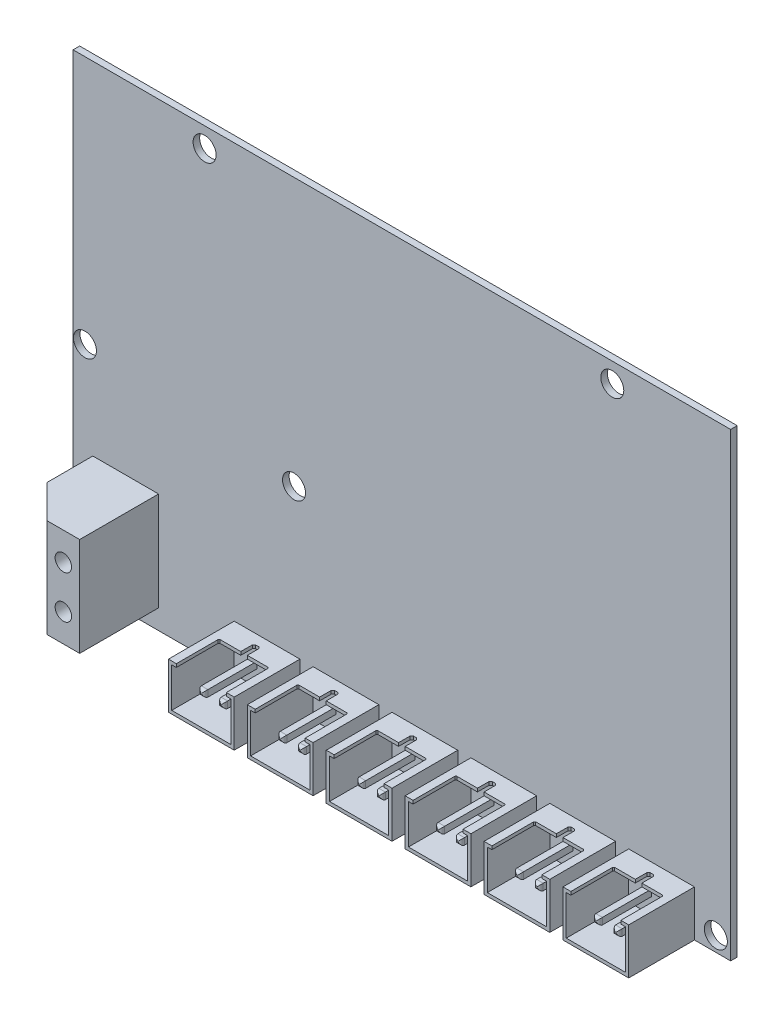
from build123d import *

# Parameters (mm, degrees)
CROQUIS1_W              = 100
CROQUIS1_H              = 70
CROQUIS1_R              = 1.75
SALIENTE_EXTRUIR1_DEPTH = 1
CROQUIS3_W              = 10
CROQUIS3_H              = 7
SALIENTE_EXTRUIR3_DEPTH = 10
VACIADO3_T              = -0.5
CORTAR_EXTRUIR1_DEPTH   = 1
CROQUIS6_W              = 1
CROQUIS6_H              = 1
SALIENTE_EXTRUIR4_DEPTH = 8
REDONDEO1_R             = 0.5
MATRIZL4_COUNT          = 6
MATRIZL4_PITCH          = 12
VACIADO4_T              = -0.5
VACIADO5_T              = -0.5
VACIADO6_T              = -0.5
VACIADO7_T              = -0.5
VACIADO8_T              = -0.5
MATRIZL5_COUNT          = 6
MATRIZL5_PITCH          = 12
MATRIZL6_COUNT          = 6
MATRIZL6_PITCH          = 12
REDONDEO2_R             = 0.5
REDONDEO3_R             = 0.5
REDONDEO4_R             = 0.5
REDONDEO5_R             = 0.5
REDONDEO6_R             = 0.5
CROQUIS13_W             = 10
CROQUIS13_H             = 15
SALIENTE_EXTRUIR5_DEPTH = 12
CHAFL_N1_SIZE           = 5
CROQUIS15_R             = 1.25
CORTAR_EXTRUIR2_DEPTH   = 9
CROQUIS16_R             = 1.25
CORTAR_EXTRUIR3_DEPTH   = 9


with BuildPart() as part:
    # Croquis1 → Saliente-Extruir1 (new body)
    with BuildSketch(Plane.XY):
        with Locations((-13.508184332, 3.054316547)):
            Rectangle(CROQUIS1_W, CROQUIS1_H)
        with Locations((-61.708184332, 0.154316547)):
            Circle(CROQUIS1_R, mode=Mode.SUBTRACT)
        with Locations((-43.508184332, 35.054316547)):
            Circle(CROQUIS1_R, mode=Mode.SUBTRACT)
        with Locations((18.491815668, 35.054316547)):
            Circle(CROQUIS1_R, mode=Mode.SUBTRACT)
        with Locations((-29.908184332, -2.645683453)):
            Circle(CROQUIS1_R, mode=Mode.SUBTRACT)
        with Locations((34.241815668, -29.695683453)):
            Circle(CROQUIS1_R, mode=Mode.SUBTRACT)
    extrude(amount=SALIENTE_EXTRUIR1_DEPTH)


with BuildPart() as body_2:
    # Croquis3 → Saliente-Extruir3 (new body)
    with BuildSketch(Plane.XY.offset(1.5)):
        with Locations((26.491815668, -27.945683453)):
            Rectangle(CROQUIS3_W, CROQUIS3_H)
    saliente_extruir3 = extrude(amount=SALIENTE_EXTRUIR3_DEPTH)

    # Vaciado3
    vaciado3_openings = [body_2.faces().sort_by_distance(p)[0] for p in [
        (26.491815668, -27.945683453, 11.5),
    ]]
    offset(amount=VACIADO3_T, openings=vaciado3_openings, kind=Kind.INTERSECTION)

    # Croquis5 → Cortar-Extruir1 (cut)
    with BuildSketch(Plane(origin=(0, -24.445683453, 0), x_dir=(1, 0, 0), z_dir=(0, 1, 0))):
        Polygon((22.691815668, -11.5), (22.691815668, -5.15), (22.841815668, -5), (25.991815668, -5), (25.991815668, -3.25), (26.241815668, -3), (26.741815668, -3), (26.991815668, -3.25), (26.991815668, -5), (30.141815668, -5), (30.291815668, -5.15), (30.291815668, -11.5), align=None)
    cortar_extruir1 = extrude(amount=-CORTAR_EXTRUIR1_DEPTH, mode=Mode.SUBTRACT)

    # Croquis6 → Saliente-Extruir4 (add)
    with BuildSketch(Plane.XY.offset(2)):
        with Locations((24.991815668, -27.96037947)):
            Rectangle(CROQUIS6_W, CROQUIS6_H)
        with Locations((27.991815668, -27.96037947)):
            Rectangle(CROQUIS6_W, CROQUIS6_H)
    saliente_extruir4 = extrude(amount=SALIENTE_EXTRUIR4_DEPTH)

    # Redondeo1
    redondeo1_edges = [body_2.edges().sort_by_distance(p)[0] for p in [
        (24.491815668, -27.96037947, 10),
        (24.991815668, -28.46037947, 10),
        (25.491815668, -27.96037947, 10),
        (24.991815668, -27.46037947, 10),
        (27.491815668, -27.96037947, 10),
        (27.991815668, -28.46037947, 10),
        (28.491815668, -27.96037947, 10),
        (27.991815668, -27.46037947, 10),
    ]]
    fillet(redondeo1_edges, radius=REDONDEO1_R - 0.0001)  # a hair under: the kernel refuses the full size


with BuildPart() as matrizl4_1:
    # MatrizL4: pattern copy
    add(saliente_extruir3.moved(Location(Vector(-1, 0, 0) * (1 * MATRIZL4_PITCH))))

    # Vaciado4
    vaciado4_openings = [matrizl4_1.faces().sort_by_distance(p)[0] for p in [
        (14.491815668, -27.945683453, 11.5),
    ]]
    offset(amount=VACIADO4_T, openings=vaciado4_openings, kind=Kind.INTERSECTION)


with BuildPart() as matrizl4_2:
    # MatrizL4: pattern copy
    add(saliente_extruir3.moved(Location(Vector(-1, 0, 0) * (2 * MATRIZL4_PITCH))))

    # Vaciado5
    vaciado5_openings = [matrizl4_2.faces().sort_by_distance(p)[0] for p in [
        (2.491815668, -27.945683453, 11.5),
    ]]
    offset(amount=VACIADO5_T, openings=vaciado5_openings, kind=Kind.INTERSECTION)


with BuildPart() as matrizl4_3:
    # MatrizL4: pattern copy
    add(saliente_extruir3.moved(Location(Vector(-1, 0, 0) * (3 * MATRIZL4_PITCH))))

    # Vaciado6
    vaciado6_openings = [matrizl4_3.faces().sort_by_distance(p)[0] for p in [
        (-9.508184332, -27.945683453, 11.5),
    ]]
    offset(amount=VACIADO6_T, openings=vaciado6_openings, kind=Kind.INTERSECTION)


with BuildPart() as matrizl4_4:
    # MatrizL4: pattern copy
    add(saliente_extruir3.moved(Location(Vector(-1, 0, 0) * (4 * MATRIZL4_PITCH))))

    # Vaciado7
    vaciado7_openings = [matrizl4_4.faces().sort_by_distance(p)[0] for p in [
        (-21.508184332, -27.945683453, 11.5),
    ]]
    offset(amount=VACIADO7_T, openings=vaciado7_openings, kind=Kind.INTERSECTION)


with BuildPart() as matrizl4_5:
    # MatrizL4: pattern copy
    add(saliente_extruir3.moved(Location(Vector(-1, 0, 0) * (5 * MATRIZL4_PITCH))))

    # Vaciado8
    vaciado8_openings = [matrizl4_5.faces().sort_by_distance(p)[0] for p in [
        (-33.508184332, -27.945683453, 11.5),
    ]]
    offset(amount=VACIADO8_T, openings=vaciado8_openings, kind=Kind.INTERSECTION)


with BuildPart() as matrizl5_tool:
    # MatrizL5: Cortar-Extruir1 ×6
    with Locations(*[(-i * MATRIZL5_PITCH, 0, 0) for i in range(1, MATRIZL5_COUNT)]):
        add(cortar_extruir1)


with BuildPart() as matrizl4_1_1:
    add(matrizl4_1.part)

    # MatrizL5: cut by matrizl5_tool
    add(matrizl5_tool.part, mode=Mode.SUBTRACT)



with BuildPart() as matrizl4_2_1:
    add(matrizl4_2.part)

    # MatrizL5: cut by matrizl5_tool
    add(matrizl5_tool.part, mode=Mode.SUBTRACT)


with BuildPart() as matrizl4_3_1:
    add(matrizl4_3.part)

    # MatrizL5: cut by matrizl5_tool
    add(matrizl5_tool.part, mode=Mode.SUBTRACT)


with BuildPart() as matrizl4_4_1:
    add(matrizl4_4.part)

    # MatrizL5: cut by matrizl5_tool
    add(matrizl5_tool.part, mode=Mode.SUBTRACT)


with BuildPart() as matrizl4_5_1:
    add(matrizl4_5.part)

    # MatrizL5: cut by matrizl5_tool
    add(matrizl5_tool.part, mode=Mode.SUBTRACT)


with BuildPart() as matrizl4_1_2:
    add(matrizl4_1_1.part)

    add(matrizl4_2_1.part)  # MatrizL6 merges MatrizL4_2

    add(matrizl4_3_1.part)  # MatrizL6 merges MatrizL4_3

    add(matrizl4_4_1.part)  # MatrizL6 merges MatrizL4_4

    add(matrizl4_5_1.part)  # MatrizL6 merges MatrizL4_5
    # MatrizL6: Saliente-Extruir4 ×6
    with Locations(*[(-i * MATRIZL6_PITCH, 0, 0) for i in range(1, MATRIZL6_COUNT)]):
        add(saliente_extruir4)

    # Redondeo2
    redondeo2_edges = [matrizl4_1_2.edges().sort_by_distance(p)[0] for p in [
        (12.491815668, -27.96037947, 10),
        (12.991815668, -28.46037947, 10),
        (13.491815668, -27.96037947, 10),
        (12.991815668, -27.46037947, 10),
        (15.491815668, -27.96037947, 10),
        (15.991815668, -28.46037947, 10),
        (16.491815668, -27.96037947, 10),
        (15.991815668, -27.46037947, 10),
    ]]
    fillet(redondeo2_edges, radius=REDONDEO2_R - 0.0001)  # a hair under: the kernel refuses the full size

    # Redondeo3
    redondeo3_edges = [matrizl4_1_2.edges().sort_by_distance(p)[0] for p in [
        (0.491815668, -27.96037947, 10),
        (0.991815668, -28.46037947, 10),
        (1.491815668, -27.96037947, 10),
        (0.991815668, -27.46037947, 10),
        (3.491815668, -27.96037947, 10),
        (3.991815668, -28.46037947, 10),
        (4.491815668, -27.96037947, 10),
        (3.991815668, -27.46037947, 10),
    ]]
    fillet(redondeo3_edges, radius=REDONDEO3_R - 0.0001)  # a hair under: the kernel refuses the full size

    # Redondeo4
    redondeo4_edges = [matrizl4_1_2.edges().sort_by_distance(p)[0] for p in [
        (-11.508184332, -27.96037947, 10),
        (-11.008184332, -28.46037947, 10),
        (-10.508184332, -27.96037947, 10),
        (-11.008184332, -27.46037947, 10),
        (-8.508184332, -27.96037947, 10),
        (-8.008184332, -28.46037947, 10),
        (-7.508184332, -27.96037947, 10),
        (-8.008184332, -27.46037947, 10),
    ]]
    fillet(redondeo4_edges, radius=REDONDEO4_R - 0.0001)  # a hair under: the kernel refuses the full size

    # Redondeo5
    redondeo5_edges = [matrizl4_1_2.edges().sort_by_distance(p)[0] for p in [
        (-23.508184332, -27.96037947, 10),
        (-23.008184332, -28.46037947, 10),
        (-22.508184332, -27.96037947, 10),
        (-23.008184332, -27.46037947, 10),
        (-20.508184332, -27.96037947, 10),
        (-20.008184332, -28.46037947, 10),
        (-19.508184332, -27.96037947, 10),
        (-20.008184332, -27.46037947, 10),
    ]]
    fillet(redondeo5_edges, radius=REDONDEO5_R - 0.0001)  # a hair under: the kernel refuses the full size

    # Redondeo6
    redondeo6_edges = [matrizl4_1_2.edges().sort_by_distance(p)[0] for p in [
        (-35.508184332, -27.96037947, 10),
        (-35.008184332, -28.46037947, 10),
        (-34.508184332, -27.96037947, 10),
        (-35.008184332, -27.46037947, 10),
        (-32.508184332, -27.96037947, 10),
        (-32.008184332, -28.46037947, 10),
        (-31.508184332, -27.96037947, 10),
        (-32.008184332, -27.46037947, 10),
    ]]
    fillet(redondeo6_edges, radius=REDONDEO6_R - 0.0001)  # a hair under: the kernel refuses the full size


with BuildPart() as body_4:
    # Croquis13 → Saliente-Extruir5 (new body)
    with BuildSketch(Plane.XY.offset(1.5)):
        with Locations((-55.008184332, -20.945683453)):
            Rectangle(CROQUIS13_W, CROQUIS13_H)
    extrude(amount=SALIENTE_EXTRUIR5_DEPTH)

    # Chaflán1
    chafl_n1_edges = [body_4.edges().sort_by_distance(p)[0] for p in [
        (-60.008184332, -20.945683453, 13.5),
    ]]
    chamfer(chafl_n1_edges, length=CHAFL_N1_SIZE)

    # Croquis15 → Cortar-Extruir2 (cut)
    with BuildSketch(Plane.XY.offset(13.5)):
        with Locations((-52.490862541, -17.695683453)):
            Circle(CROQUIS15_R)
        with Locations((-52.490862541, -24.195683453)):
            Circle(CROQUIS15_R)
    extrude(amount=-CORTAR_EXTRUIR2_DEPTH, mode=Mode.SUBTRACT)

    # Croquis16 → Cortar-Extruir3 (cut)
    with BuildSketch(Plane(origin=(-60.008184332, 0, -60.008184332), x_dir=(0, 0, -1), z_dir=(1, 0, 0))):
        with Locations((-64.990862541, -17.695683453)):
            Circle(CROQUIS16_R)
        with Locations((-64.990862541, -24.195683453)):
            Circle(CROQUIS16_R)
    extrude(amount=CORTAR_EXTRUIR3_DEPTH, mode=Mode.SUBTRACT)


solid = Compound([part.part, body_2.part, matrizl4_1_2.part, body_4.part])
